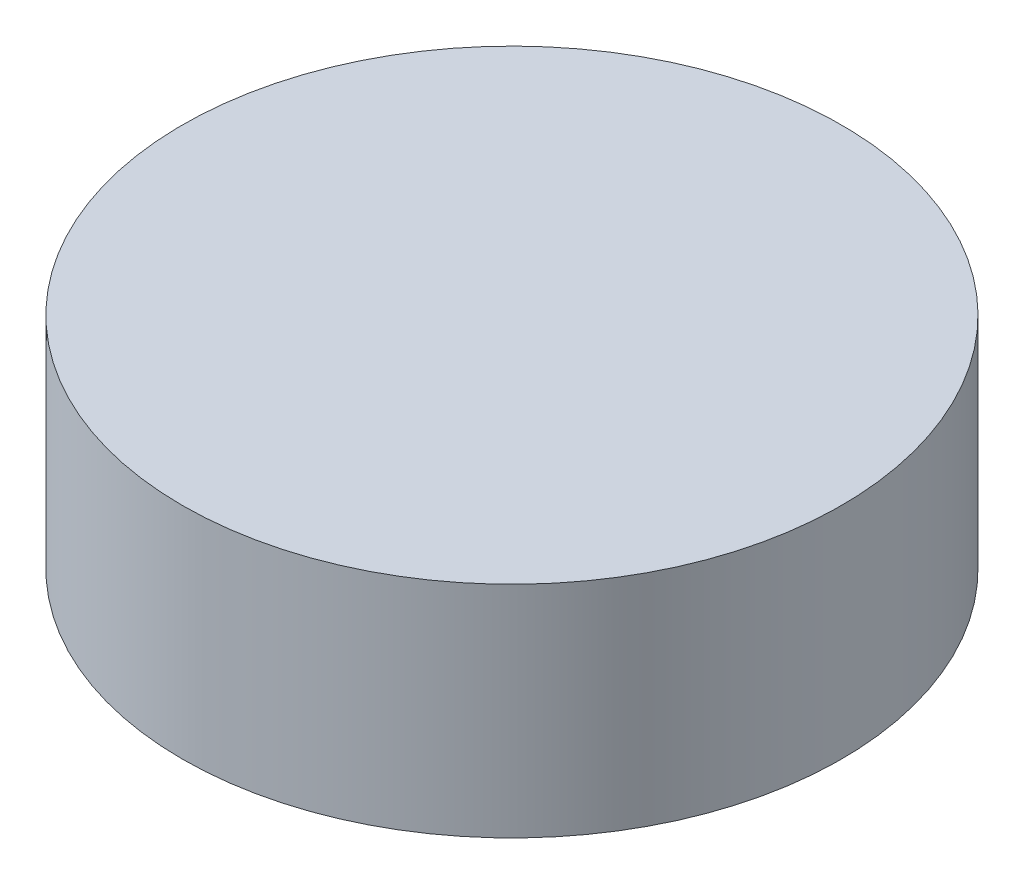
from build123d import *

# Parameters (mm, degrees)
SKETCH1_R           = 30
BOSS_EXTRUDE1_DEPTH = 10


with BuildPart() as part:
    # Sketch1 → Boss-Extrude1 (new, symmetric)
    with BuildSketch(Plane(origin=(0, 0, 0), x_dir=(1, 0, 0), z_dir=(0, 1, 0))):
        Circle(SKETCH1_R)
    extrude(amount=BOSS_EXTRUDE1_DEPTH, both=True)


solid = part.part
